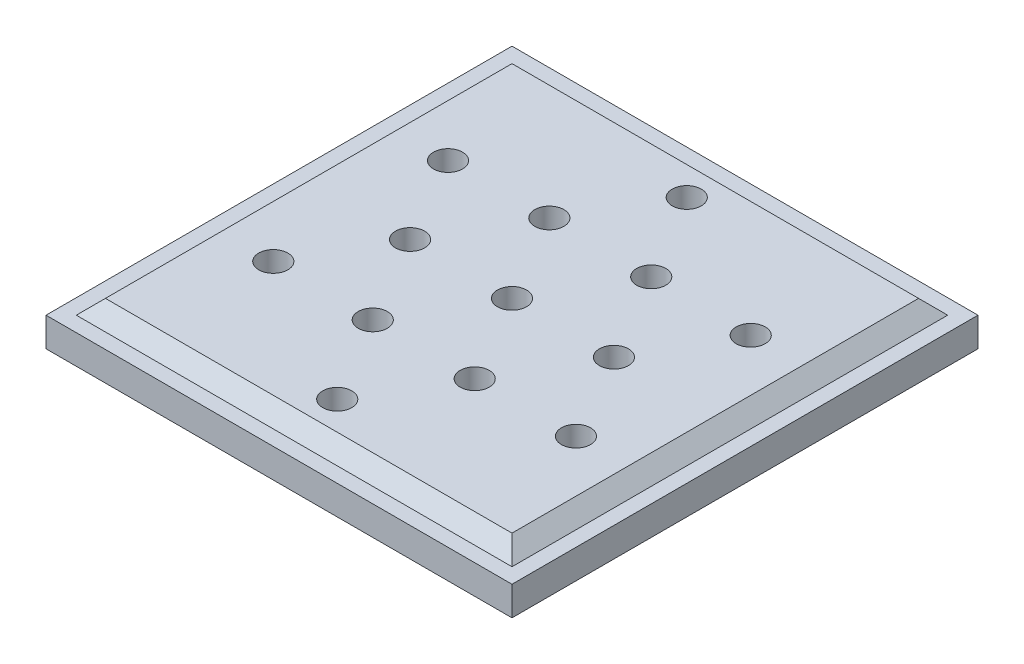
from build123d import *

# Parameters (mm, degrees)
SKETCH1_W           = 101.6
SKETCH1_H           = 101.6
BOSS_EXTRUDE1_DEPTH = 9.525
SKETCH2_OUTSIDE_W   = 132.4
SKETCH2_OUTSIDE_H   = 132.4
SKETCH2_OUTSIDE_W_2 = 94.996
SKETCH2_OUTSIDE_H_2 = 94.996
CUT_EXTRUDE1_DEPTH  = 3.175
CHAMFER1_SIZE       = 3.175
CUT_EXTRUDE2_REACH  = 74.471
SKETCH3_R           = 3.175


with BuildPart() as part:
    # Sketch1 → Boss-Extrude1 (new body)
    with BuildSketch(Plane(origin=(0, 0, 0), x_dir=(1, 0, 0), z_dir=(0, 1, 0))):
        Rectangle(SKETCH1_W, SKETCH1_H)
    extrude(amount=BOSS_EXTRUDE1_DEPTH)

    # Sketch2 outside → Cut-Extrude1 (cut)
    with BuildSketch(Plane(origin=(0, 9.525, 0), x_dir=(1, 0, 0), z_dir=(0, 1, 0))):
        Rectangle(SKETCH2_OUTSIDE_W, SKETCH2_OUTSIDE_H)
        Rectangle(SKETCH2_OUTSIDE_W_2, SKETCH2_OUTSIDE_H_2, mode=Mode.SUBTRACT)
    extrude(amount=-CUT_EXTRUDE1_DEPTH, mode=Mode.SUBTRACT)

    # Chamfer1
    chamfer1_edges = [part.edges().sort_by_distance(p)[0] for p in [
        (47.498, 9.525, 0),
        (0, 9.525, -47.498),
        (-47.498, 9.525, 0),
        (0, 9.525, 47.498),
    ]]
    chamfer(chamfer1_edges, length=CHAMFER1_SIZE - 0.0001)  # a hair under: the kernel refuses the full size

    # Sketch3 → Cut-Extrude2 (cut, up to next)
    with BuildSketch(Plane(origin=(0, 9.525, 0), x_dir=(1, 0, 0), z_dir=(0, 1, 0)), mode=Mode.PRIVATE) as cut_extrude2_sk1:
        with Locations(Location((0, 38.1, 0), (0, 0, 270))):
            Circle(SKETCH3_R)
    cut_extrude2_tool1 = extrude(cut_extrude2_sk1.sketch, amount=-CUT_EXTRUDE2_REACH, mode=Mode.PRIVATE) & part.part
    # Sketch3 → Cut-Extrude2 (cut, up to next)
    with BuildSketch(Plane(origin=(0, 9.525, 0), x_dir=(1, 0, 0), z_dir=(0, 1, 0)), mode=Mode.PRIVATE) as cut_extrude2_sk2:
        with Locations(Location((32.995567884, 19.05, 0), (0, 0, 270))):
            Circle(SKETCH3_R)
    cut_extrude2_tool2 = extrude(cut_extrude2_sk2.sketch, amount=-CUT_EXTRUDE2_REACH, mode=Mode.PRIVATE) & part.part
    # Sketch3 → Cut-Extrude2 (cut, up to next)
    with BuildSketch(Plane(origin=(0, 9.525, 0), x_dir=(1, 0, 0), z_dir=(0, 1, 0)), mode=Mode.PRIVATE) as cut_extrude2_sk3:
        with Locations(Location((32.995567884, -19.05, 0), (0, 0, 270))):
            Circle(SKETCH3_R)
    cut_extrude2_tool3 = extrude(cut_extrude2_sk3.sketch, amount=-CUT_EXTRUDE2_REACH, mode=Mode.PRIVATE) & part.part
    # Sketch3 → Cut-Extrude2 (cut, up to next)
    with BuildSketch(Plane(origin=(0, 9.525, 0), x_dir=(1, 0, 0), z_dir=(0, 1, 0)), mode=Mode.PRIVATE) as cut_extrude2_sk4:
        with Locations(Location((0, -38.1, 0), (0, 0, 270))):
            Circle(SKETCH3_R)
    cut_extrude2_tool4 = extrude(cut_extrude2_sk4.sketch, amount=-CUT_EXTRUDE2_REACH, mode=Mode.PRIVATE) & part.part
    # Sketch3 → Cut-Extrude2 (cut, up to next)
    with BuildSketch(Plane(origin=(0, 9.525, 0), x_dir=(1, 0, 0), z_dir=(0, 1, 0)), mode=Mode.PRIVATE) as cut_extrude2_sk5:
        with Locations(Location((-32.995567884, -19.05, 0), (0, 0, 270))):
            Circle(SKETCH3_R)
    cut_extrude2_tool5 = extrude(cut_extrude2_sk5.sketch, amount=-CUT_EXTRUDE2_REACH, mode=Mode.PRIVATE) & part.part
    # Sketch3 → Cut-Extrude2 (cut, up to next)
    with BuildSketch(Plane(origin=(0, 9.525, 0), x_dir=(1, 0, 0), z_dir=(0, 1, 0)), mode=Mode.PRIVATE) as cut_extrude2_sk6:
        with Locations(Location((-32.995567884, 19.05, 0), (0, 0, 270))):
            Circle(SKETCH3_R)
    cut_extrude2_tool6 = extrude(cut_extrude2_sk6.sketch, amount=-CUT_EXTRUDE2_REACH, mode=Mode.PRIVATE) & part.part
    # Sketch3 → Cut-Extrude2 (cut, up to next)
    with BuildSketch(Plane(origin=(0, 9.525, 0), x_dir=(1, 0, 0), z_dir=(0, 1, 0)), mode=Mode.PRIVATE) as cut_extrude2_sk7:
        with Locations(Location((22.225, 0, 0), (0, 0, 270))):
            Circle(SKETCH3_R)
    cut_extrude2_tool7 = extrude(cut_extrude2_sk7.sketch, amount=-CUT_EXTRUDE2_REACH, mode=Mode.PRIVATE) & part.part
    # Sketch3 → Cut-Extrude2 (cut, up to next)
    with BuildSketch(Plane(origin=(0, 9.525, 0), x_dir=(1, 0, 0), z_dir=(0, 1, 0)), mode=Mode.PRIVATE) as cut_extrude2_sk8:
        with Locations(Location((11.1125, -19.247414599, 0), (0, 0, 270))):
            Circle(SKETCH3_R)
    cut_extrude2_tool8 = extrude(cut_extrude2_sk8.sketch, amount=-CUT_EXTRUDE2_REACH, mode=Mode.PRIVATE) & part.part
    # Sketch3 → Cut-Extrude2 (cut, up to next)
    with BuildSketch(Plane(origin=(0, 9.525, 0), x_dir=(1, 0, 0), z_dir=(0, 1, 0)), mode=Mode.PRIVATE) as cut_extrude2_sk9:
        with Locations(Location((-11.1125, -19.247414599, 0), (0, 0, 270))):
            Circle(SKETCH3_R)
    cut_extrude2_tool9 = extrude(cut_extrude2_sk9.sketch, amount=-CUT_EXTRUDE2_REACH, mode=Mode.PRIVATE) & part.part
    # Sketch3 → Cut-Extrude2 (cut, up to next)
    with BuildSketch(Plane(origin=(0, 9.525, 0), x_dir=(1, 0, 0), z_dir=(0, 1, 0)), mode=Mode.PRIVATE) as cut_extrude2_sk10:
        with Locations(Location((-22.225, 0, 0), (0, 0, 270))):
            Circle(SKETCH3_R)
    cut_extrude2_tool10 = extrude(cut_extrude2_sk10.sketch, amount=-CUT_EXTRUDE2_REACH, mode=Mode.PRIVATE) & part.part
    # Sketch3 → Cut-Extrude2 (cut, up to next)
    with BuildSketch(Plane(origin=(0, 9.525, 0), x_dir=(1, 0, 0), z_dir=(0, 1, 0)), mode=Mode.PRIVATE) as cut_extrude2_sk11:
        with Locations(Location((-11.1125, 19.247414599, 0), (0, 0, 270))):
            Circle(SKETCH3_R)
    cut_extrude2_tool11 = extrude(cut_extrude2_sk11.sketch, amount=-CUT_EXTRUDE2_REACH, mode=Mode.PRIVATE) & part.part
    # Sketch3 → Cut-Extrude2 (cut, up to next)
    with BuildSketch(Plane(origin=(0, 9.525, 0), x_dir=(1, 0, 0), z_dir=(0, 1, 0)), mode=Mode.PRIVATE) as cut_extrude2_sk12:
        with Locations(Location((11.1125, 19.247414599, 0), (0, 0, 270))):
            Circle(SKETCH3_R)
    cut_extrude2_tool12 = extrude(cut_extrude2_sk12.sketch, amount=-CUT_EXTRUDE2_REACH, mode=Mode.PRIVATE) & part.part
    # Sketch3 → Cut-Extrude2 (cut, up to next)
    with BuildSketch(Plane(origin=(0, 9.525, 0), x_dir=(1, 0, 0), z_dir=(0, 1, 0)), mode=Mode.PRIVATE) as cut_extrude2_sk13:
        with Locations(Location((0, 0, 0), (0, 0, 270))):
            Circle(SKETCH3_R)
    cut_extrude2_tool13 = extrude(cut_extrude2_sk13.sketch, amount=-CUT_EXTRUDE2_REACH, mode=Mode.PRIVATE) & part.part
    add(cut_extrude2_tool1.solids().sort_by_distance((0, 9.525, -38.1))[0], mode=Mode.SUBTRACT)
    add(cut_extrude2_tool2.solids().sort_by_distance((32.995568, 9.525, -19.05))[0], mode=Mode.SUBTRACT)
    add(cut_extrude2_tool3.solids().sort_by_distance((32.995568, 9.525, 19.05))[0], mode=Mode.SUBTRACT)
    add(cut_extrude2_tool4.solids().sort_by_distance((0, 9.525, 38.1))[0], mode=Mode.SUBTRACT)
    add(cut_extrude2_tool5.solids().sort_by_distance((-32.995568, 9.525, 19.05))[0], mode=Mode.SUBTRACT)
    add(cut_extrude2_tool6.solids().sort_by_distance((-32.995568, 9.525, -19.05))[0], mode=Mode.SUBTRACT)
    add(cut_extrude2_tool7.solids().sort_by_distance((22.225, 9.525, 0))[0], mode=Mode.SUBTRACT)
    add(cut_extrude2_tool8.solids().sort_by_distance((11.1125, 9.525, 19.247415))[0], mode=Mode.SUBTRACT)
    add(cut_extrude2_tool9.solids().sort_by_distance((-11.1125, 9.525, 19.247415))[0], mode=Mode.SUBTRACT)
    add(cut_extrude2_tool10.solids().sort_by_distance((-22.225, 9.525, 0))[0], mode=Mode.SUBTRACT)
    add(cut_extrude2_tool11.solids().sort_by_distance((-11.1125, 9.525, -19.247415))[0], mode=Mode.SUBTRACT)
    add(cut_extrude2_tool12.solids().sort_by_distance((11.1125, 9.525, -19.247415))[0], mode=Mode.SUBTRACT)
    add(cut_extrude2_tool13.solids().sort_by_distance((0, 9.525, 0))[0], mode=Mode.SUBTRACT)


solid = part.part
